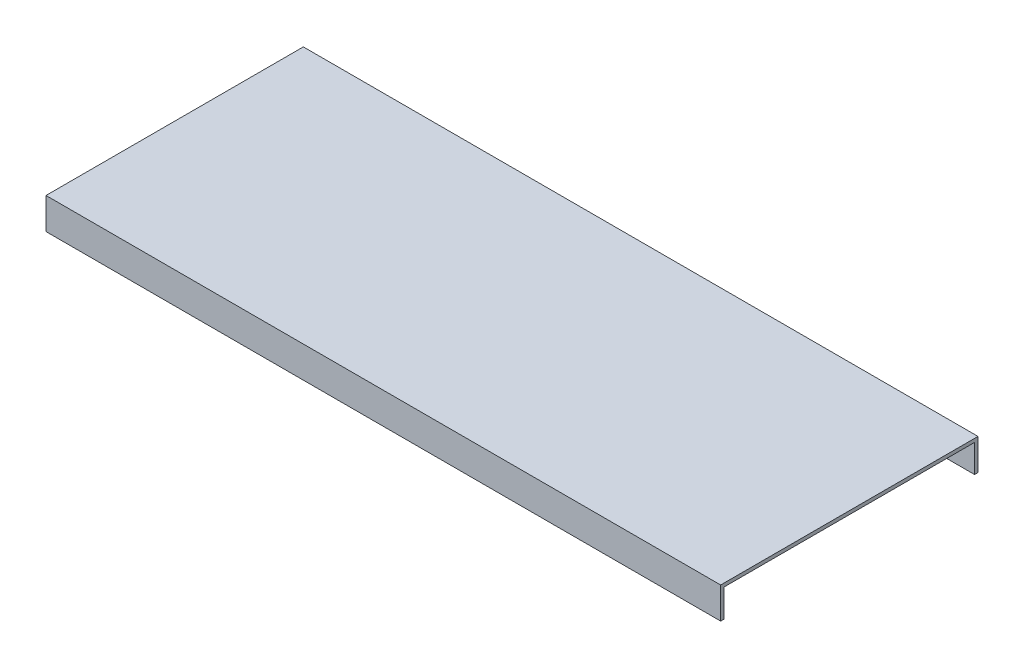
from build123d import *

# Parameters (mm, degrees)
SKETCH1_W           = 307.975
SKETCH1_H           = 117.475
BOSS_EXTRUDE1_DEPTH = 1.5875
BOSS_EXTRUDE2_DEPTH = 12.7


with BuildPart() as part:
    # Sketch1 → Boss-Extrude1 (new body)
    with BuildSketch(Plane(origin=(0, 0, 0), x_dir=(1, 0, 0), z_dir=(0, 1, 0))):
        Rectangle(SKETCH1_W, SKETCH1_H)
    extrude(amount=BOSS_EXTRUDE1_DEPTH)

    # Sketch2 → Boss-Extrude2 (add)
    with BuildSketch(Plane.XZ):
        Polygon((-152.4, 57.15), (152.4, 57.15), (153.9875, 57.15), (153.9875, 58.7375), (-153.9875, 58.7375), (-153.9875, -58.7375), (153.9875, -58.7375), (153.9875, -57.15), (152.4, -57.15), (-152.4, -57.15), align=None)
    extrude(amount=BOSS_EXTRUDE2_DEPTH)


solid = part.part
